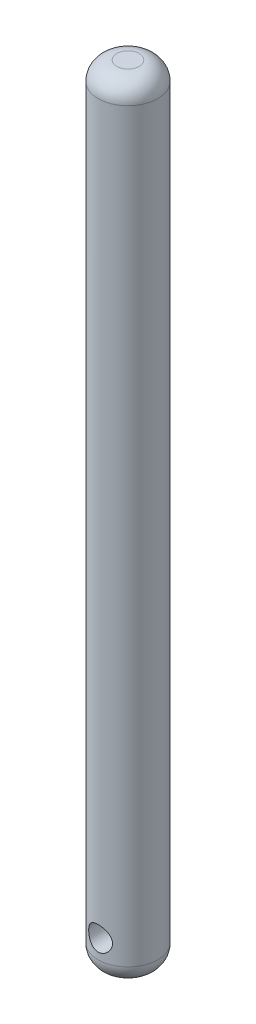
from build123d import *

# Parameters (mm, degrees)
SKETCH1_R               = 4
BOSS_EXTRUDE1_DEPTH     = 105
CUT_EXTRUDE1_DEPTH      = 106.152270541
CUT_EXTRUDE1_DEPTH_BACK = 106.152270541
SKETCH2_R               = 1.6
CUT_EXTRUDE2_REACH      = 108.152
CUT_EXTRUDE2_END_RADIUS = 4
CUT_EXTRUDE2_START      = -1
SKETCH3_R               = 3
FILLET1_R               = 2.5


with BuildPart() as part:
    # Sketch1 → Boss-Extrude1 (new body)
    with BuildSketch(Plane(origin=(0, 0, 0), x_dir=(1, 0, 0), z_dir=(0, 1, 0))):
        with Locations(Location((0, 0, 0), (0, 0, 270))):
            Circle(SKETCH1_R)
    extrude(amount=BOSS_EXTRUDE1_DEPTH)

    # Sketch2 → Cut-Extrude1 (cut, two sides: drawn at the far end of the back side and taken through both)
    with BuildSketch(Plane.XY.offset(-CUT_EXTRUDE1_DEPTH_BACK)):
        with Locations(Location((0, 5, 0), (0, 0, 89.999999999))):
            Circle(SKETCH2_R)
    extrude(amount=CUT_EXTRUDE1_DEPTH + CUT_EXTRUDE1_DEPTH_BACK, mode=Mode.SUBTRACT)

    # Cut-Extrude2: up to this cylinder (the profile starts inside it)
    cut_extrude2_end = Plane(origin=(0, 5, 0), z_dir=(0, -1, 0)) * Cylinder(CUT_EXTRUDE2_END_RADIUS, 225.304, mode=Mode.PRIVATE)
    # Sketch3 → Cut-Extrude2 (cut, up to the surface)
    with BuildSketch(Plane.XY.offset(CUT_EXTRUDE2_START), mode=Mode.PRIVATE) as cut_extrude2_sk1:
        with Locations((0, 5)):
            Circle(SKETCH3_R)
    cut_extrude2_tool1 = extrude(cut_extrude2_sk1.sketch, amount=-CUT_EXTRUDE2_REACH, mode=Mode.PRIVATE) & cut_extrude2_end
    add(cut_extrude2_tool1.solids().sort_by_distance((0, 5, -1))[0], mode=Mode.SUBTRACT)

    # Fillet1
    # the kernel refuses this fillet: 2.5 mm, written as the material it takes off along each edge
    with BuildSketch(Plane(origin=(0, 0, 0), x_dir=(0, 0, 1), z_dir=(-1, 0, 0))) as fillet1_piece_1:
        with BuildLine():
            CenterArc((4 - FILLET1_R, FILLET1_R), FILLET1_R, 270, 90)
            Line((4 - FILLET1_R, 0), (4, 0))
            Line((4, 0), (4, FILLET1_R))
        make_face()
    revolve(axis=Axis((0, 0, 0), (0, 1, 0)), mode=Mode.SUBTRACT)
    with BuildSketch(Plane(origin=(0, 105, 0), x_dir=(0, 0, 1), z_dir=(-1, 0, 0))) as fillet1_piece_2:
        with BuildLine():
            CenterArc((4 - FILLET1_R, -FILLET1_R), FILLET1_R, 0, 90)
            Line((4 - FILLET1_R, 0), (4, 0))
            Line((4, 0), (4, -FILLET1_R))
        make_face()
    revolve(axis=Axis((0, 105, 0), (0, 1, 0)), mode=Mode.SUBTRACT)


solid = part.part
